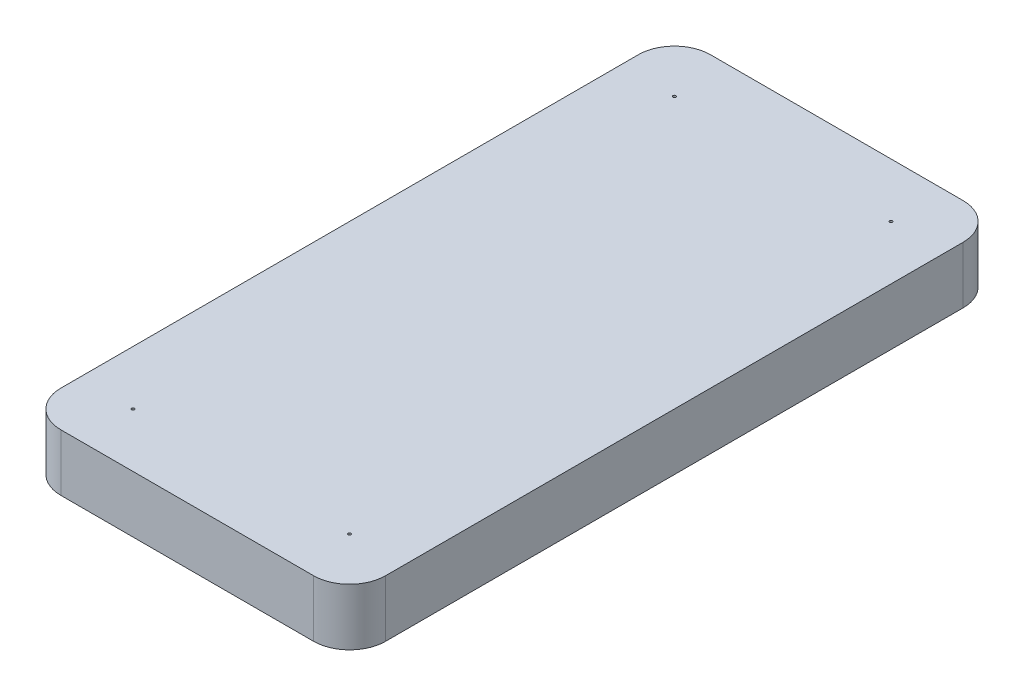
from build123d import *

# Parameters (mm, degrees)
SKETCH1_W           = 114.3
SKETCH1_H           = 228.6
BOSS_EXTRUDE2_DEPTH = 20
SKETCH5_R           = 0.5
CUT_EXTRUDE1_DEPTH  = 257.363901515
FILLET1_R           = 12.7


with BuildPart() as part:
    # Sketch1 → Boss-Extrude2 (new body)
    with BuildSketch(Plane(origin=(0, 0, 0), x_dir=(1, 0, 0), z_dir=(0, 1, 0))):
        with Locations((57.15, 114.3)):
            Rectangle(SKETCH1_W, SKETCH1_H)
    extrude(amount=BOSS_EXTRUDE2_DEPTH)

    # Sketch5 → Cut-Extrude1 (cut, through all)
    with BuildSketch(Plane(origin=(0, 20, 0), x_dir=(1, 0, 0), z_dir=(0, 1, 0))):
        with Locations((19.05, 209.55)):
            Circle(SKETCH5_R)
        with Locations((19.05, 19.05)):
            Circle(SKETCH5_R)
        with Locations((95.25, 209.55)):
            Circle(SKETCH5_R)
        with Locations((95.25, 19.05)):
            Circle(SKETCH5_R)
    extrude(amount=-CUT_EXTRUDE1_DEPTH, mode=Mode.SUBTRACT)

    # Fillet1
    fillet1_edges = [part.edges().sort_by_distance(p)[0] for p in [
        (0, 10, -228.6),
        (114.3, 10, -228.6),
        (0, 10, 0),
        (114.3, 10, 0),
    ]]
    fillet(fillet1_edges, radius=FILLET1_R)


solid = part.part
